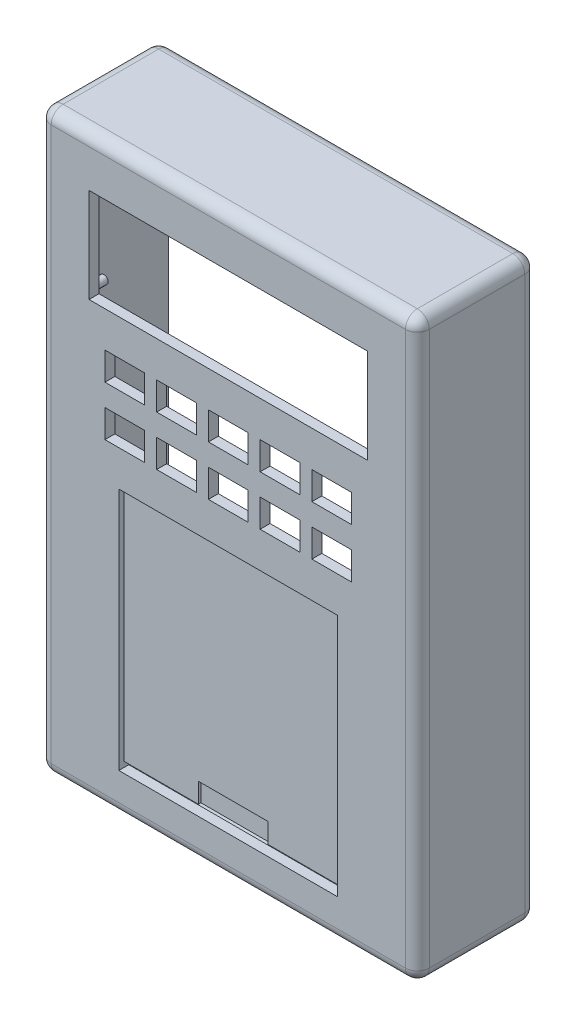
from build123d import *

# Parameters (mm, degrees)
SKETCH1_W           = 120.65
SKETCH1_H           = 184.15
BOSS_EXTRUDE1_DEPTH = 38.1
FILLET1_R           = 3.81
SKETCH2_W           = 88.9
SKETCH2_H           = 30.1625
CUT_EXTRUDE1_DEPTH  = 3.175
SKETCH3_W           = 114.3
SKETCH3_H           = 177.8
CUT_EXTRUDE2_DEPTH  = 34.925
SKETCH4_W           = 69.85
SKETCH4_H           = 77.7875
CUT_EXTRUDE3_DEPTH  = 1.5875
SKETCH5_W           = 69.85
SKETCH5_H           = 1.778
CUT_EXTRUDE4_DEPTH  = 3.175
SKETCH6_W           = 6.35
SKETCH6_H           = 6.35
BOSS_EXTRUDE2_DEPTH = 31.75
SKETCH7_R           = 1.322959
BOSS_EXTRUDE3_DEPTH = 4.7625
SKETCH8_W           = 22.225
SKETCH8_H           = 6.35
CUT_EXTRUDE5_DEPTH  = 0.79375
SKETCH9_R           = 1.905
CUT_EXTRUDE6_DEPTH  = 15.875
SKETCH11_W          = 12.7
SKETCH11_H          = 8.89
CUT_EXTRUDE8_DEPTH  = 224.417092435


with BuildPart() as part:
    # Sketch1 → Boss-Extrude1 (new body)
    with BuildSketch(Plane.XY):
        with Locations((60.325, 92.075)):
            Rectangle(SKETCH1_W, SKETCH1_H)
    extrude(amount=BOSS_EXTRUDE1_DEPTH)

    # Fillet1
    fillet1_edges = [part.edges().sort_by_distance(p)[0] for p in [
        (0, 0, 19.05),
        (60.325, 0, 0),
        (0, 92.075, 0),
        (120.65, 0, 19.05),
        (60.325, 0, 38.1),
        (0, 92.075, 38.1),
        (0, 184.15, 19.05),
        (60.325, 184.15, 0),
        (120.65, 92.075, 0),
        (60.325, 184.15, 38.1),
        (120.65, 92.075, 38.1),
        (120.65, 184.15, 19.05),
    ]]
    fillet(fillet1_edges, radius=FILLET1_R)

    # Sketch2 → Cut-Extrude1 (cut)
    with BuildSketch(Plane.XY.offset(38.1)):
        with Locations((60.325, 153.19375)):
            Rectangle(SKETCH2_W, SKETCH2_H)
    extrude(amount=-CUT_EXTRUDE1_DEPTH, mode=Mode.SUBTRACT)

    # Sketch3 → Cut-Extrude2 (cut)
    with BuildSketch(Plane(origin=(0, 0, 0), x_dir=(-1, 0, 0), z_dir=(0, 0, -1))):
        with Locations((-60.325, 92.075)):
            Rectangle(SKETCH3_W, SKETCH3_H)
    extrude(amount=-CUT_EXTRUDE2_DEPTH, mode=Mode.SUBTRACT)

    # Sketch4 → Cut-Extrude3 (cut)
    with BuildSketch(Plane.XY.offset(38.1)):
        with Locations((60.325, 51.59375)):
            Rectangle(SKETCH4_W, SKETCH4_H)
    extrude(amount=-CUT_EXTRUDE3_DEPTH, mode=Mode.SUBTRACT)

    # Sketch5 → Cut-Extrude4 (cut)
    with BuildSketch(Plane.XY.offset(36.5125)):
        with Locations((60.325, 13.589)):
            Rectangle(SKETCH5_W, SKETCH5_H)
    extrude(amount=-CUT_EXTRUDE4_DEPTH, mode=Mode.SUBTRACT)

    # Sketch6 → Boss-Extrude2 (add)
    with BuildSketch(Plane(origin=(0, 0, 34.925), x_dir=(-1, 0, 0), z_dir=(0, 0, -1))):
        with Locations((-114.3, 177.8)):
            Rectangle(SKETCH6_W, SKETCH6_H)
        with Locations((-6.35, 177.8)):
            Rectangle(SKETCH6_W, SKETCH6_H)
        with Locations((-114.3, 6.35)):
            Rectangle(SKETCH6_W, SKETCH6_H)
        with Locations((-6.35, 6.35)):
            Rectangle(SKETCH6_W, SKETCH6_H)
    extrude(amount=BOSS_EXTRUDE2_DEPTH)

    # Sketch7 → Boss-Extrude3 (add)
    with BuildSketch(Plane(origin=(0, 0, 34.925), x_dir=(-1, 0, 0), z_dir=(0, 0, -1))):
        with Locations((-107.95, 171.45)):
            Circle(SKETCH7_R)
        with Locations((-12.7, 171.45)):
            Circle(SKETCH7_R)
        with Locations((-12.7, 138.1125)):
            Circle(SKETCH7_R)
        with Locations((-107.95, 138.1125)):
            Circle(SKETCH7_R)
    extrude(amount=BOSS_EXTRUDE3_DEPTH)

    # Sketch8 → Cut-Extrude5 (cut)
    with BuildSketch(Plane.XY.offset(36.5125)):
        with Locations((60.325, 17.653)):
            Rectangle(SKETCH8_W, SKETCH8_H)
    extrude(amount=-CUT_EXTRUDE5_DEPTH, mode=Mode.SUBTRACT)

    # Sketch9 → Cut-Extrude6 (cut)
    with BuildSketch(Plane(origin=(0, 0, 3.175), x_dir=(-1, 0, 0), z_dir=(0, 0, -1))):
        with Locations((-114.3, 177.8)):
            Circle(SKETCH9_R)
        with Locations((-6.35, 177.8)):
            Circle(SKETCH9_R)
        with Locations((-6.35, 6.35)):
            Circle(SKETCH9_R)
        with Locations((-114.3, 6.35)):
            Circle(SKETCH9_R)
    extrude(amount=-CUT_EXTRUDE6_DEPTH, mode=Mode.SUBTRACT)

    # Sketch11 → Cut-Extrude8 (cut, through all)
    with BuildSketch(Plane.XY.offset(38.1)):
        with Locations((27.305, 122.2375)):
            Rectangle(SKETCH11_W, SKETCH11_H)
        with Locations((43.815, 122.2375)):
            Rectangle(SKETCH11_W, SKETCH11_H)
        with Locations((60.325, 122.2375)):
            Rectangle(SKETCH11_W, SKETCH11_H)
        with Locations((76.835, 122.2375)):
            Rectangle(SKETCH11_W, SKETCH11_H)
        with Locations((93.345, 122.2375)):
            Rectangle(SKETCH11_W, SKETCH11_H)
        with Locations((27.305, 106.3625)):
            Rectangle(SKETCH11_W, SKETCH11_H)
        with Locations((43.815, 106.3625)):
            Rectangle(SKETCH11_W, SKETCH11_H)
        with Locations((60.325, 106.3625)):
            Rectangle(SKETCH11_W, SKETCH11_H)
        with Locations((76.835, 106.3625)):
            Rectangle(SKETCH11_W, SKETCH11_H)
        with Locations((93.345, 106.3625)):
            Rectangle(SKETCH11_W, SKETCH11_H)
    extrude(amount=-CUT_EXTRUDE8_DEPTH, mode=Mode.SUBTRACT)


solid = part.part
